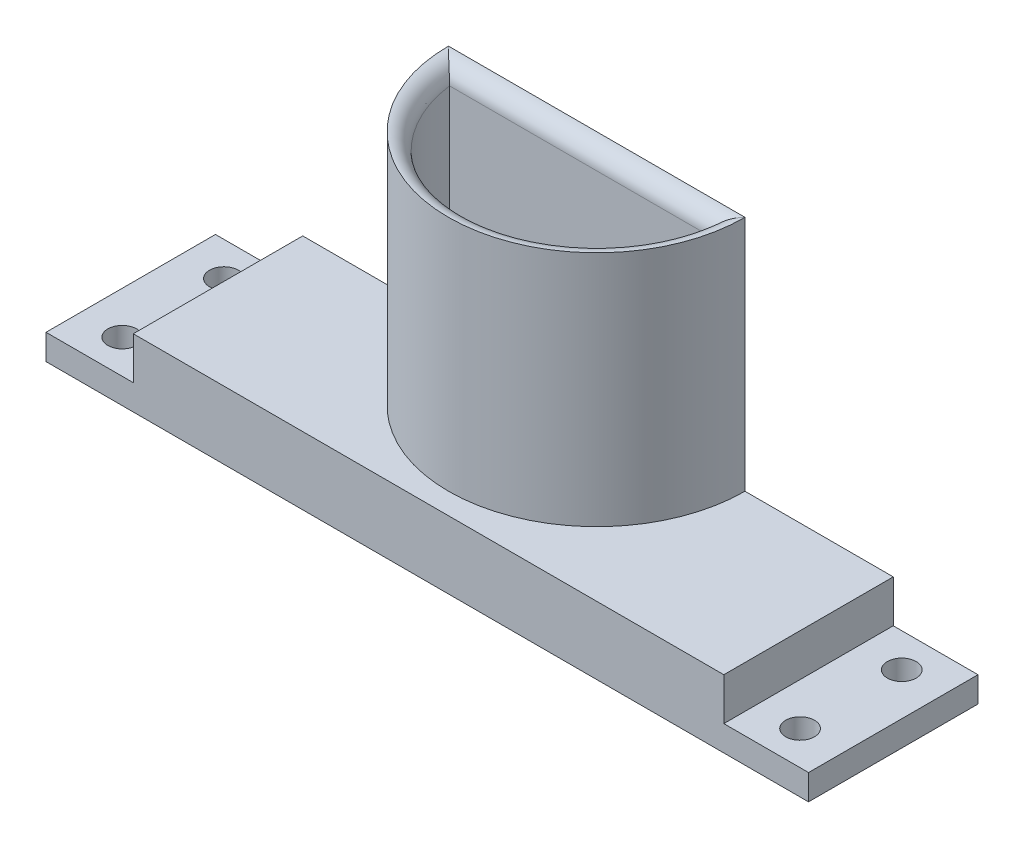
from build123d import *

# Parameters (mm, degrees)
SKETCH1_W                = 70
SKETCH1_H                = 20
BOSS_EXTRUDE1_DEPTH      = 5
SKETCH2_W                = 90
SKETCH2_H                = 20
BOSS_EXTRUDE2_DEPTH      = 3
BOSS_EXTRUDE3_DEPTH      = 28
CUT_EXTRUDE1_DEPTH       = 59.489315264
FILLET1_R                = 2
FILLET2_R                = 2
M3_CLEARANCE_HOLE1_D     = 3.4
M3_CLEARANCE_HOLE1_DEPTH = 10
M3_CLEARANCE_HOLE1_TIP   = 1.021463052
SKETCH9_W                = 20
SKETCH9_H                = 5
CUT_EXTRUDE2_DEPTH       = 0.3


with BuildPart() as part:
    # Sketch1 → Boss-Extrude1 (new body)
    with BuildSketch(Plane(origin=(0, 0, 0), x_dir=(1, 0, 0), z_dir=(0, 1, 0))):
        Rectangle(SKETCH1_W, SKETCH1_H)
    extrude(amount=BOSS_EXTRUDE1_DEPTH)

    # Sketch2 → Boss-Extrude2 (add)
    with BuildSketch(Plane.XZ):
        Rectangle(SKETCH2_W, SKETCH2_H)
    extrude(amount=BOSS_EXTRUDE2_DEPTH)

    # Sketch4 → Boss-Extrude3 (add)
    with BuildSketch(Plane(origin=(0, 5, 0), x_dir=(1, 0, 0), z_dir=(0, 1, 0))):
        with BuildLine():
            Line((17.5, 10), (-17.5, 10))
            ThreePointArc((-17.5, 10), (0, -7.5), (17.5, 10))
        make_face()
    extrude(amount=BOSS_EXTRUDE3_DEPTH)

    # Sketch6 → Cut-Extrude1 (cut, through all)
    with BuildSketch(Plane(origin=(0, 33, 0), x_dir=(1, 0, 0), z_dir=(0, 1, 0))):
        with BuildLine():
            Line((15.370426149, 8), (-15.370426149, 8))
            ThreePointArc((-15.370426149, 8), (0, -5.5), (15.370426149, 8))
        make_face()
    extrude(amount=-CUT_EXTRUDE1_DEPTH, mode=Mode.SUBTRACT)

    # Fillet1
    fillet1_edges = [part.edges().sort_by_distance(p)[0] for p in [
        (0, 33, 5.5),
        (0, 33, -8),
    ]]
    fillet(fillet1_edges, radius=FILLET1_R - 0.0001)  # a hair under: the kernel refuses the full size

    # Fillet2
    fillet2_edges = [part.edges().sort_by_distance(p)[0] for p in [
        (0, -3, 5.5),
        (0, -3, -8),
    ]]
    fillet(fillet2_edges, radius=FILLET2_R - 0.0001)  # a hair under: the kernel refuses the full size

    # M3 Clearance Hole1
    with Locations(Plane(origin=(0, 0, 0), x_dir=(1, 0, 0), z_dir=(0, 1, 0))):
        with Locations((-40, 6), (-40, -6), (40, 6), (40, -6)):
            Hole(M3_CLEARANCE_HOLE1_D / 2, depth=M3_CLEARANCE_HOLE1_DEPTH)
            with Locations((0, 0, -(M3_CLEARANCE_HOLE1_DEPTH + M3_CLEARANCE_HOLE1_TIP / 2))):  # 118° drill point
                Cone(0, M3_CLEARANCE_HOLE1_D / 2, M3_CLEARANCE_HOLE1_TIP, mode=Mode.SUBTRACT)

    # Sketch9 → Cut-Extrude2 (cut)
    with BuildSketch(Plane.ZY.offset(35)):
        with Locations((0, 2.5)):
            Rectangle(SKETCH9_W, SKETCH9_H)
    extrude(amount=-CUT_EXTRUDE2_DEPTH, mode=Mode.SUBTRACT)


solid = part.part
